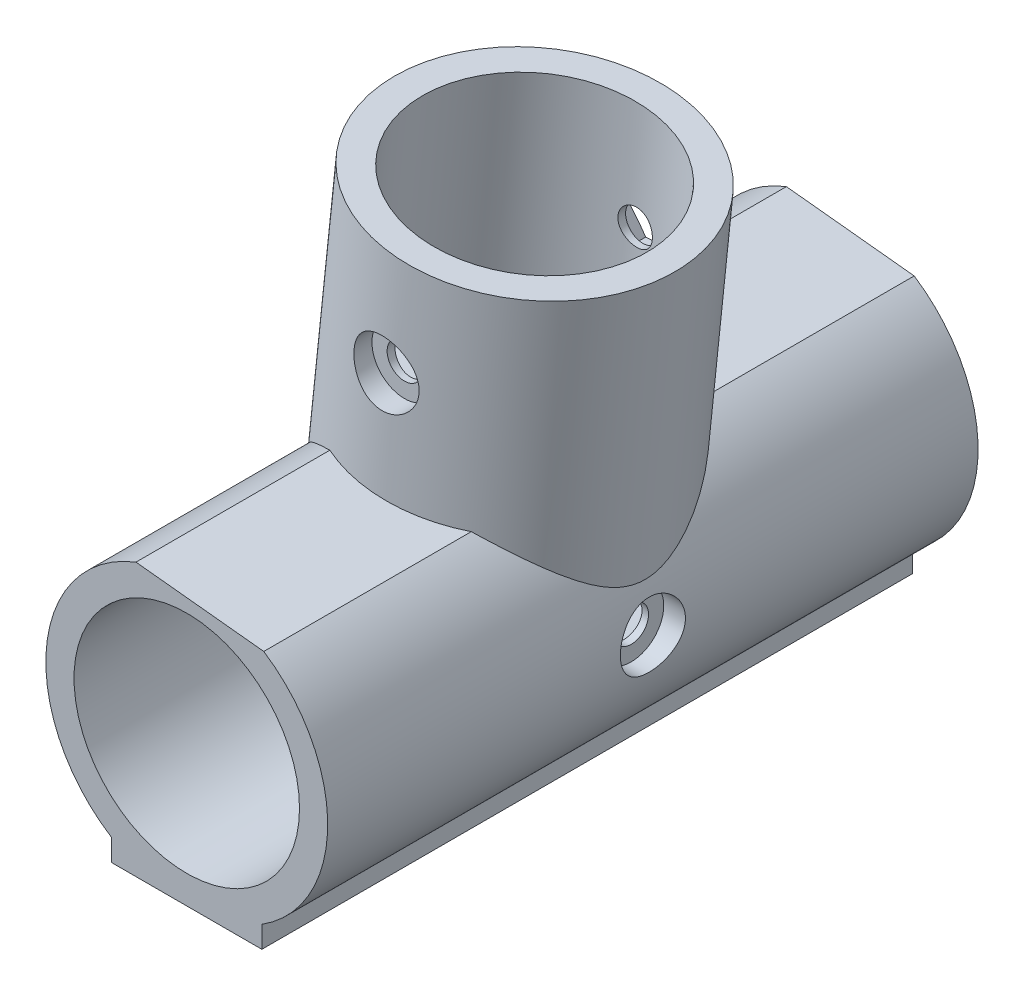
from build123d import *

# Parameters (mm, degrees)
SKETCH1_W            = 26
SKETCH1_H            = 26
SKETCH1_R            = 10.4
BOSS_EXTRUDE2_DEPTH  = 60
SKETCH2_R            = 1.6
CUT_EXTRUDE1_DEPTH   = 67.670833203
CUT_EXTRUDE2_DEPTH   = 2
SKETCH4_R            = 3
CUT_EXTRUDE3_DEPTH   = 2
CUT_EXTRUDE5_DEPTH   = 63.753486055
SKETCH7_W            = 26
SKETCH7_H            = 26
BOSS_EXTRUDE3_DEPTH  = 20
SKETCH8_R            = 1.6
CUT_EXTRUDE6_DEPTH   = 57.177126928
SKETCH9_R            = 3
CUT_EXTRUDE7_DEPTH   = 2
CUT_EXTRUDE8_DEPTH   = 2
SKETCH11_OUTSIDE_W   = 50.774
SKETCH11_OUTSIDE_H   = 78.112
SKETCH11_OUTSIDE_R   = 13
SKETCH11_OUTSIDE_R_2 = 10.4
CUT_EXTRUDE9_DEPTH   = 20
SKETCH5_OUTSIDE_W    = 46.131
SKETCH5_OUTSIDE_H    = 63.995
CUT_EXTRUDE4_DEPTH   = 71.049051406
SKETCH13_R           = 13
BOSS_EXTRUDE4_DEPTH  = 7
FILLET1_R            = 2
SKETCH14_R           = 10.4
CUT_EXTRUDE10_DEPTH  = 71.049051406


with BuildPart() as part:
    # Sketch1 → Boss-Extrude2 (new body)
    with BuildSketch(Plane.XY):
        Rectangle(SKETCH1_W, SKETCH1_H)
        Circle(SKETCH1_R, mode=Mode.SUBTRACT)
    extrude(amount=BOSS_EXTRUDE2_DEPTH)

    # Sketch2 → Cut-Extrude1 (cut, through all)
    with BuildSketch(Plane.ZY.offset(13)):
        with Locations((30, 0)):
            Circle(SKETCH2_R)
    extrude(amount=-CUT_EXTRUDE1_DEPTH, mode=Mode.SUBTRACT)

    # Sketch3 → Cut-Extrude2 (cut)
    with BuildSketch(Plane.ZY.offset(13)):
        Polygon((33.348631561, 0), (31.674315781, 2.9), (28.325684219, 2.9), (26.651368439, 0), (28.325684219, -2.9), (31.674315781, -2.9), align=None)
    extrude(amount=-CUT_EXTRUDE2_DEPTH, mode=Mode.SUBTRACT)

    # Sketch4 → Cut-Extrude3 (cut)
    with BuildSketch(Plane(origin=(13, 0, 0), x_dir=(0, 0, -1), z_dir=(1, 0, 0))):
        with Locations((-30, 0)):
            Circle(SKETCH4_R)
    extrude(amount=-CUT_EXTRUDE3_DEPTH, mode=Mode.SUBTRACT)

    # Sketch6 → Cut-Extrude5 (cut, through all)
    with BuildSketch(Plane.XY.offset(60)):
        Polygon((-13, 13), (13, 13), (13, 10.267289883), align=None)
    extrude(amount=-CUT_EXTRUDE5_DEPTH, mode=Mode.SUBTRACT)

    # Sketch7 → Boss-Extrude3 (add)
    with BuildSketch(Plane(origin=(1.209385395, 11.506533414, 0), x_dir=(0.9945218953682742, -0.1045284632676464, 0), z_dir=(0.1045284632676464, 0.9945218953682742, 0))):
        with Locations((-1.216047028, -30)):
            Rectangle(SKETCH7_W, SKETCH7_H)
    extrude(amount=BOSS_EXTRUDE3_DEPTH)

    # Sketch8 → Cut-Extrude6 (cut, through all)
    with BuildSketch(Plane.XY.offset(43)):
        with Locations((1.080892313, 21.575121377)):
            Circle(SKETCH8_R)
    extrude(amount=-CUT_EXTRUDE6_DEPTH, mode=Mode.SUBTRACT)

    # Sketch9 → Cut-Extrude7 (cut)
    with BuildSketch(Plane.XY.offset(43)):
        with Locations((1.080892313, 21.575121377)):
            Circle(SKETCH9_R)
    extrude(amount=-CUT_EXTRUDE7_DEPTH, mode=Mode.SUBTRACT)

    # Sketch10 → Cut-Extrude8 (cut)
    with BuildSketch(Plane(origin=(0, 0, 17), x_dir=(-1, 0, 0), z_dir=(0, 0, -1))):
        Polygon((2.267739249, 21.575121377), (0.593423468, 24.475121377), (-2.755208093, 24.475121377), (-4.429523874, 21.575121377), (-2.755208093, 18.675121377), (0.593423468, 18.675121377), align=None)
    extrude(amount=-CUT_EXTRUDE8_DEPTH, mode=Mode.SUBTRACT)

    # Sketch11 outside → Cut-Extrude9 (cut)
    # profile 1 of 2: a face of its own
    with BuildSketch(Plane(origin=(3.29995466, 31.396971322, 0), x_dir=(0.9945218953682742, -0.10452846326764643, 0), z_dir=(0.10452846326764643, 0.9945218953682742, 0))):
        with Locations((-0.035, -30)):
            Rectangle(SKETCH11_OUTSIDE_W, SKETCH11_OUTSIDE_H)
        with Locations(Location((-1.216047028, -30, 0), (0, 0, 180))):
            Circle(SKETCH11_OUTSIDE_R, mode=Mode.SUBTRACT)
    # profile 2 of 2: a face of its own
    with BuildSketch(Plane(origin=(3.29995466, 31.396971322, 0), x_dir=(0.9945218953682742, -0.10452846326764643, 0), z_dir=(0.10452846326764643, 0.9945218953682742, 0))):
        with Locations(Location((-1.216047028, -30, 0), (0, 0, 180))):
            Circle(SKETCH11_OUTSIDE_R_2)
    extrude(amount=-CUT_EXTRUDE9_DEPTH, mode=Mode.SUBTRACT)

    # Sketch5 outside → Cut-Extrude4 (cut, through all)
    with BuildSketch(Plane.XY.offset(60)):
        with Locations((1.0095, 9.9415)):
            Rectangle(SKETCH5_OUTSIDE_W, SKETCH5_OUTSIDE_H)
        with BuildLine():
            Line((-6.92820323, -11), (-6.92820323, -13))
            Line((-6.92820323, -13), (6.92820323, -13))
            Line((6.92820323, -13), (6.92820323, -11))
            ThreePointArc((6.92820323, -11), (12.999577974, -0.104749706), (7.104566567, 10.886924906))
            Line((7.104566567, 10.886924906), (13, 10.267289883))
            Line((13, 10.267289883), (15.291712761, 31.831368542))
            Line((15.291712761, 31.831368542), (-10.708287239, 34.594506849))
            Line((-10.708287239, 34.594506849), (-13, 13))
            Line((-13, 13), (-4.685795776, 12.126141923))
            ThreePointArc((-4.685795776, 12.126141923), (-12.939314251, 1.254650033), (-6.92820323, -11))
        make_face(mode=Mode.SUBTRACT)
    extrude(amount=-CUT_EXTRUDE4_DEPTH, mode=Mode.SUBTRACT)

    # Sketch13 → Boss-Extrude4 (add)
    with BuildSketch(Plane(origin=(1.209385395, 11.506533414, 0), x_dir=(0.9945218953682741, -0.10452846326764687, 0), z_dir=(-0.10452846326764687, -0.9945218953682741, 0))):
        with Locations(Location((-1.216047028, 30, 0), (0, 0, 180))):
            Circle(SKETCH13_R)
    extrude(amount=BOSS_EXTRUDE4_DEPTH)

    # Fillet1
    # the kernel refuses this fillet: 2 mm, written as the material it adds along each edge
    with BuildSketch(Plane(origin=(-11.625930527, 5.817021522, 16.479857089), x_dir=(-0.36199929686843824, -0.9321783676243277, 0), z_dir=(0, 0, 1))) as fillet1_piece_1_section:
        with BuildLine():
            CenterArc((2.614603278, -1.991261329), FILLET1_R, 95.358010672, 99.865019887)
            Line((0.684781224, -2.516415439), (0, 0))
            ThreePointArc((0, 0), (1.213922951, -0.056801359), (2.427845901, 0))
        make_face()
    fillet1_piece_1 = extrude(amount=27.040285822, mode=Mode.PRIVATE)
    fillet1_piece_1 = fillet1_piece_1 & Plane(origin=(-0.793541371, 4.083603133, 30), x_dir=(-0.9945218953682741, 0.10452846326764687, 0), z_dir=(0.10452846326764687, 0.9945218953682741, 0)) * Cylinder(13, 65, mode=Mode.PRIVATE)
    add(fillet1_piece_1)

    # Sketch14 → Cut-Extrude10 (cut, through all)
    with BuildSketch(Plane.XY.offset(60)):
        Circle(SKETCH14_R)
    extrude(amount=-CUT_EXTRUDE10_DEPTH, mode=Mode.SUBTRACT)


solid = part.part
